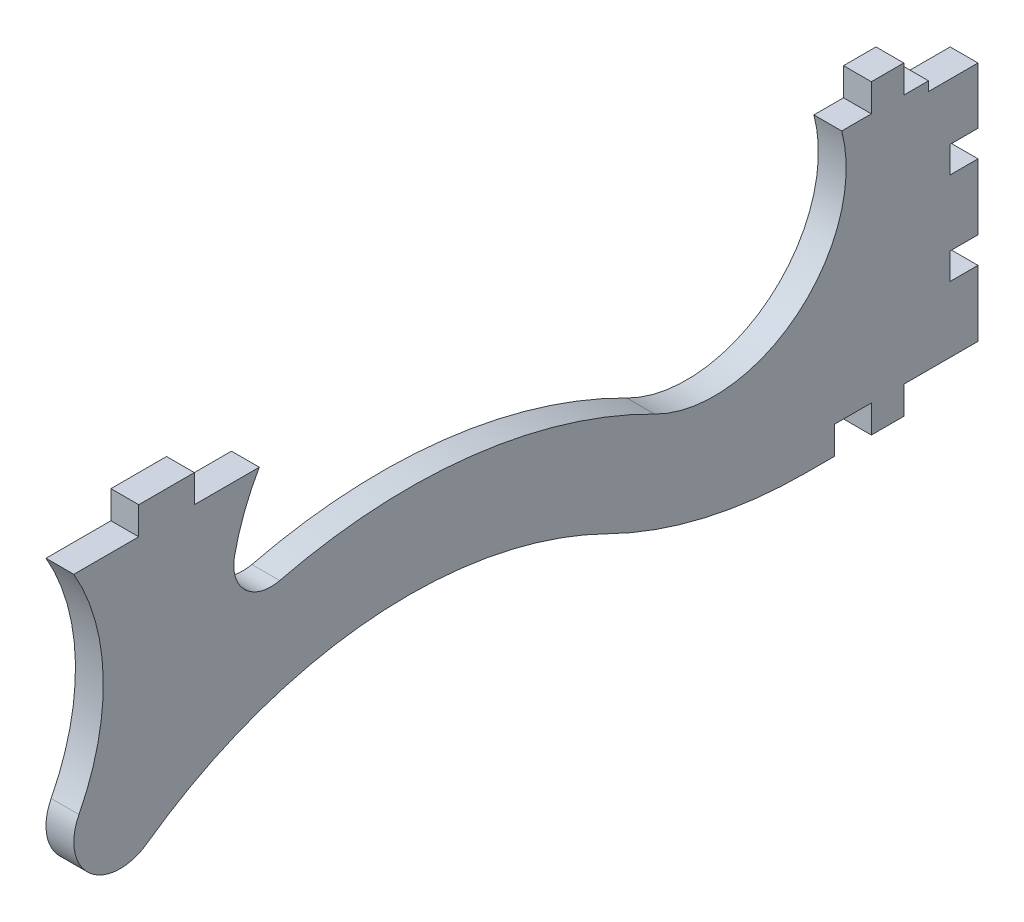
from build123d import *

# Parameters (mm, degrees)
BOSS_EXTRUDE1_DEPTH      = 1.5
BOSS_EXTRUDE1_DEPTH_BACK = 1.5
CUT_EXTRUDE1_DEPTH       = 106.347045521


with BuildPart() as part:
    # Sketch1 → Boss-Extrude1 (new, two sides: drawn at the far end of the back side and taken through both)
    with BuildSketch(Plane(origin=(0, 0, 0), x_dir=(0, 0, -1), z_dir=(1, 0, 0)).offset(-BOSS_EXTRUDE1_DEPTH_BACK)):
        with BuildLine():
            Line((-80, 30), (-87, 30))
            Line((-87, 30), (-87, 33))
            Line((-87, 33), (-93, 33))
            Line((-93, 33), (-93, 30))
            Line((-93, 30), (-100, 30))
            ThreePointArc((-100, 30), (-96.828033965, 18.713629613), (-99.446714265, 7.28620477))
            ThreePointArc((-99.446714265, 7.28620477), (-98.266775294, 1.214741861), (-92.088027506, 0.935468515))
            ThreePointArc((-92.088027506, 0.935468515), (-67.824329395, 9.838481267), (-42.435753596, 5))
            ThreePointArc((-42.435753596, 5), (-32.005584176, 1.266555107), (-21, 0))
            Line((-21, 0), (-18, 0))
            Line((-18, 0), (-18, 3))
            Line((-18, 3), (-14, 3))
            Line((-14, 3), (-14, 0))
            Line((-14, 0), (-10.5, 0))
            Line((-10.5, 0), (-10.5, 3))
            Line((-10.5, 3), (-2.5, 3))
            Line((-2.5, 3), (-2.5, 10.1))
            Line((-2.5, 10.1), (-5.5, 10.1))
            Line((-5.5, 10.1), (-5.5, 12.95))
            Line((-5.5, 12.95), (-2.5, 12.95))
            Line((-2.5, 12.95), (-2.5, 20.05))
            Line((-2.5, 20.05), (-5.5, 20.05))
            Line((-5.5, 20.05), (-5.5, 22.9))
            Line((-5.5, 22.9), (-2.5, 22.9))
            Line((-2.5, 22.9), (-2.5, 30))
            Line((-2.5, 30), (-10.5, 30))
            Line((-10.5, 30), (-10.5, 33))
            Line((-10.5, 33), (-14, 33))
            Line((-14, 33), (-14, 30))
            Line((-14, 30), (-17.196152423, 30))
            ThreePointArc((-17.196152423, 30), (-21.977621067, 15.2751291), (-37.373673558, 13.648527389))
            ThreePointArc((-37.373673558, 13.648527389), (-57.168725688, 19.61440017), (-77.802405966, 18.315567968))
            ThreePointArc((-77.802405966, 18.315567968), (-81.536934186, 19.325375212), (-82.669963788, 23.024382595))
            ThreePointArc((-82.669963788, 23.024382595), (-81.611172702, 26.61790516), (-80, 30))
        make_face()
    extrude(amount=BOSS_EXTRUDE1_DEPTH + BOSS_EXTRUDE1_DEPTH_BACK)

    # Sketch2 → Cut-Extrude1 (cut, through all)
    with BuildSketch(Plane(origin=(1.5, 0, 0), x_dir=(0, 0, -1), z_dir=(1, 0, 0))):
        Polygon((-7.833333333, 30), (-5.166666667, 30), (-2.5, 30), (-2.5, 29), (-7.833333333, 29), align=None)
    extrude(amount=-CUT_EXTRUDE1_DEPTH, mode=Mode.SUBTRACT)


solid = part.part
